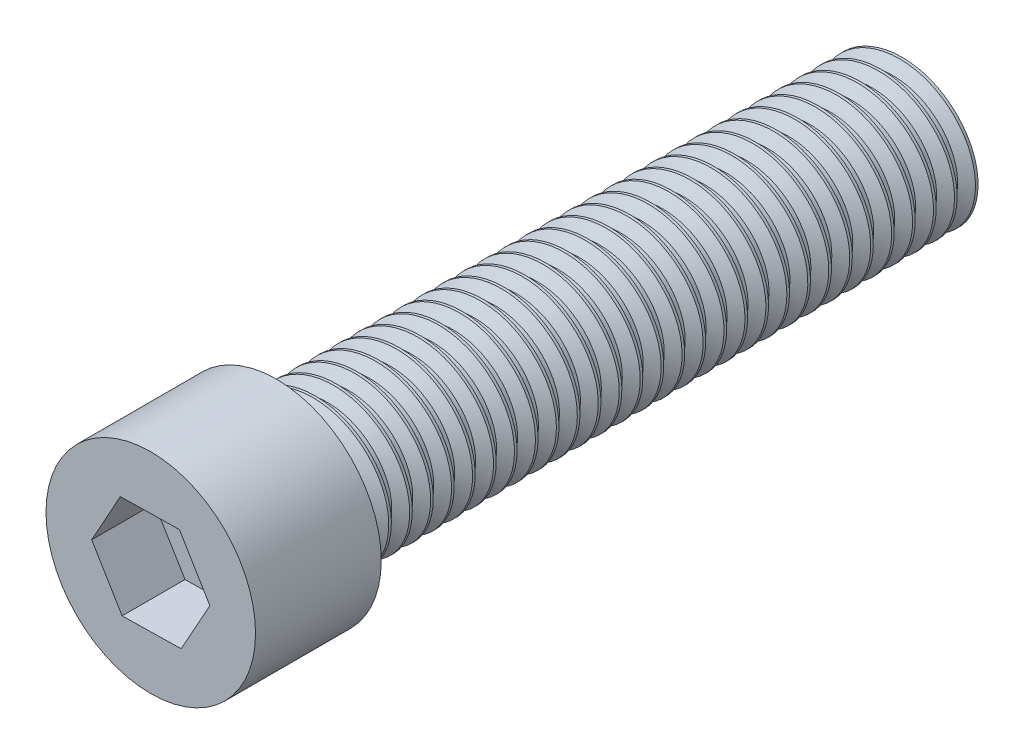
from build123d import *

# Parameters (mm, degrees)
SKETCH1_R           = 1.5
BOSS_EXTRUDE1_DEPTH = 15
THREAD1_PITCH       = 0.5
SKETCH4_R           = 2.5
BOSS_EXTRUDE2_DEPTH = 3
CUT_EXTRUDE1_DEPTH  = 1.5


with BuildPart() as part:
    # Sketch1 → Boss-Extrude1 (new body)
    with BuildSketch(Plane.XY):
        Circle(SKETCH1_R)
    extrude(amount=BOSS_EXTRUDE1_DEPTH)

    # Thread1: the profile of Thread Profile1 profile screwed along a right-hand helix of 30 turns, 6 arcs to a turn; built about Z, then put on its axis
    thread1_z = Axis((0, 0, 0), (0, 0, 1))
    thread1_corners = [(1.4997, 0, -0.000173205), (1.770632937, 0, 0.156249999), (1.770632937, 0, 0.218749999), (1.4997, 0, 0.375173204)]
    with BuildLine(mode=Mode.PRIVATE) as thread1_profile:
        Line(thread1_corners[0], thread1_corners[1])
        Line(thread1_corners[1], thread1_corners[2])
        Line(thread1_corners[2], thread1_corners[3])
        Line(thread1_corners[3], thread1_corners[0])
    thread1_cap = Face(thread1_profile.wire())
    thread1_turn_angles = [0, 30, 60, 90, 120, 150, 180, 210, 240, 270, 300, 330, 360]
    thread1_turn_weights = [1, 0.8660254037844387, 1, 0.8660254037844387, 1, 0.8660254037844387, 1, 0.8660254037844387, 1, 0.8660254037844387, 1, 0.8660254037844387, 1]
    thread1_turn_rails = [Edge.make_bspline([Vector(p[0], p[1], 0).rotate(thread1_z, thread1_turn_angles[k]) / thread1_turn_weights[k] + Vector(0, 0, p[2] + THREAD1_PITCH * thread1_turn_angles[k] / 360) for k in range(13)], [0, 0, 0, 1, 1, 2, 2, 3, 3, 4, 4, 5, 5, 6, 6, 6], 2, thread1_turn_weights) for p in thread1_corners]
    thread1_turn_sides = [Face.make_surface_from_curves(thread1_turn_rails[p[0]], thread1_turn_rails[p[1]]) for p in [(0, 1), (1, 2), (2, 3), (3, 0)]]
    thread1 = Plane(origin=(0, 0, 15), x_dir=(-1, 0, 0), z_dir=(0, 0, -1)) * Solid(Shell([*[p.moved(Location((0, 0, THREAD1_PITCH * i))) for i in range(30) for p in thread1_turn_sides], thread1_cap, thread1_cap.rotate(thread1_z, 10800).moved(Location((0, 0, THREAD1_PITCH * 10800 / 360)))]))
    add(thread1)

    # Sketch4 → Boss-Extrude2 (add)
    with BuildSketch(Plane.XY.offset(15)):
        Circle(SKETCH4_R)
    extrude(amount=BOSS_EXTRUDE2_DEPTH)

    # Sketch5 → Cut-Extrude1 (cut)
    with BuildSketch(Plane.XY.offset(18)):
        Polygon((0.726797293, -1.208695498), (1.410159653, 0.02507717), (0.68336236, 1.233772668), (-0.726797293, 1.208695498), (-1.410159653, -0.02507717), (-0.68336236, -1.233772668), align=None)
    extrude(amount=-CUT_EXTRUDE1_DEPTH, mode=Mode.SUBTRACT)


solid = part.part
